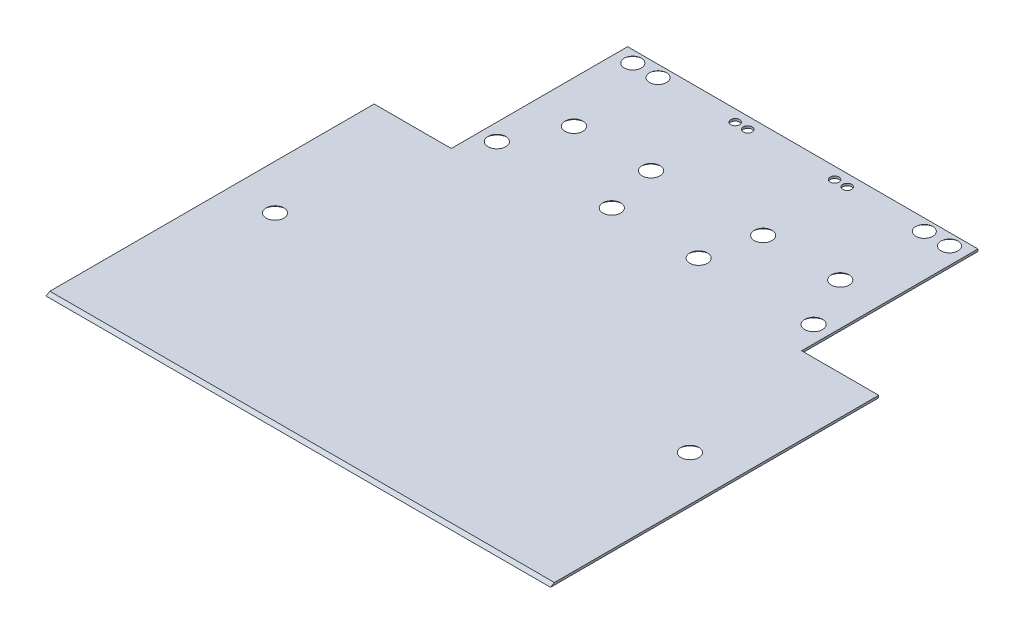
from build123d import *

# Parameters (mm, degrees)
SALIENTE_EXTRUIR1_DEPTH                      = 0.8
CORTAR_EXTRUIR1_REACH                        = 203.248
CORTAR_EXTRUIR2_REACH                        = 129.282
CROQUIS3_R                                   = 1.585
CORTAR_EXTRUIR3_REACH                        = 129.282
CROQUIS4_R                                   = 1.585
CORTAR_EXTRUIR4_REACH                        = 129.282
CROQUIS6_R                                   = 1.585
CORTAR_EXTRUIR5_REACH                        = 129.282
CROQUIS7_R                                   = 1.585
CROQUIS15_R                                  = 4
CORTAR_EXTRUIR6_DEPTH                        = 2
CORTAR_EXTRUIR6_DRAFT                        = -50.5
CORTAR_EXTRUIR6_PROFILE_2_DEPTH              = 2
CORTAR_EXTRUIR6_PROFILE_2_DRAFT              = -50.5
CORTAR_EXTRUIR6_PROFILE_3_DEPTH              = 2
CORTAR_EXTRUIR6_PROFILE_3_DRAFT              = -50.5
CORTAR_EXTRUIR6_PROFILE_4_DEPTH              = 2
CORTAR_EXTRUIR6_PROFILE_4_DRAFT              = -50.5
CORTAR_EXTRUIR6_PROFILE_5_DEPTH              = 2
CORTAR_EXTRUIR6_PROFILE_5_DRAFT              = -50.5
CORTAR_EXTRUIR6_PROFILE_6_DEPTH              = 2
CORTAR_EXTRUIR6_PROFILE_6_DRAFT              = -50.5
CORTAR_EXTRUIR6_PROFILE_7_DEPTH              = 2
CORTAR_EXTRUIR6_PROFILE_7_DRAFT              = -50.5
SIMETR_A3_COPY_1_SKETCH_R                    = 4
SIMETR_A3_COPY_1_DEPTH                       = 2
SIMETR_A3_COPY_1_DRAFT                       = -50.5
SIMETR_A3_COPY_2_SKETCH_R                    = 4
SIMETR_A3_COPY_2_DEPTH                       = 2
SIMETR_A3_COPY_2_DRAFT                       = -50.5
SIMETR_A3_COPY_3_SKETCH_R                    = 4
SIMETR_A3_COPY_3_DEPTH                       = 2
SIMETR_A3_COPY_3_DRAFT                       = -50.5
SIMETR_A3_COPY_4_SKETCH_R                    = 4
SIMETR_A3_COPY_4_DEPTH                       = 2
SIMETR_A3_COPY_4_DRAFT                       = -50.5
SIMETR_A3_COPY_5_SKETCH_R                    = 4
SIMETR_A3_COPY_5_DEPTH                       = 2
SIMETR_A3_COPY_5_DRAFT                       = -50.5
SIMETR_A3_COPY_6_SKETCH_R                    = 4
SIMETR_A3_COPY_6_DEPTH                       = 2
SIMETR_A3_COPY_6_DRAFT                       = -50.5
SIMETR_A3_COPY_7_SKETCH_R                    = 4
SIMETR_A3_COPY_7_DEPTH                       = 2
SIMETR_A3_COPY_7_DRAFT                       = -50.5
SIMETR_A3_COPY_8_SKETCH_R                    = 4
SIMETR_A3_COPY_8_DEPTH                       = 2
SIMETR_A3_COPY_8_DRAFT                       = -50.5
SIMETR_A3_COPY_9_SKETCH_R                    = 4
SIMETR_A3_COPY_9_DEPTH                       = 2
SIMETR_A3_COPY_9_DRAFT                       = -50.5
SIMETR_A3_COPY_10_SKETCH_R                   = 4
SIMETR_A3_COPY_10_DEPTH                      = 2
SIMETR_A3_COPY_10_DRAFT                      = -50.5
SIMETR_A3_COPY_11_SKETCH_R                   = 4
SIMETR_A3_COPY_11_DEPTH                      = 2
SIMETR_A3_COPY_11_DRAFT                      = -50.5
SIMETR_A3_COPY_12_SKETCH_R                   = 4
SIMETR_A3_COPY_12_DEPTH                      = 2
SIMETR_A3_COPY_12_DRAFT                      = -50.5
SIMETR_A3_COPY_13_SKETCH_R                   = 4
SIMETR_A3_COPY_13_DEPTH                      = 2
SIMETR_A3_COPY_13_DRAFT                      = -50.5
AVELLANADO_PARA_TORNILLO_CON_CABEZA_2_COUNT  = 2
AVELLANADO_PARA_TORNILLO_CON_CABEZA_2_PITCH  = 64.066814151
AVELLANADO_PARA_TORNILLO_CON_CABEZA_3_COUNT  = 2
AVELLANADO_PARA_TORNILLO_CON_CABEZA_3_PITCH  = 84.398647009
AVELLANADO_PARA_TORNILLO_CON_CABEZA_4_COUNT  = 2
AVELLANADO_PARA_TORNILLO_CON_CABEZA_4_PITCH  = 96.627540675
AVELLANADO_PARA_TORNILLO_CON_CABEZA_5_COUNT  = 2
AVELLANADO_PARA_TORNILLO_CON_CABEZA_5_PITCH  = 84.973858777
AVELLANADO_PARA_TORNILLO_CON_CABEZA_6_COUNT  = 2
AVELLANADO_PARA_TORNILLO_CON_CABEZA_6_PITCH  = 108.667183066
AVELLANADO_PARA_TORNILLO_CON_CABEZA_7_COUNT  = 2
AVELLANADO_PARA_TORNILLO_CON_CABEZA_7_PITCH  = 123.518750062
AVELLANADO_PARA_TORNILLO_CON_CABEZA_8_COUNT  = 2
AVELLANADO_PARA_TORNILLO_CON_CABEZA_8_PITCH  = 145.544259993
AVELLANADO_PARA_TORNILLO_CON_CABEZA_9_COUNT  = 2
AVELLANADO_PARA_TORNILLO_CON_CABEZA_9_PITCH  = 144.321019521
AVELLANADO_PARA_TORNILLO_CON_CABEZA_10_COUNT = 2
AVELLANADO_PARA_TORNILLO_CON_CABEZA_10_PITCH = 148


with BuildPart() as part:
    # Croquis1 → Saliente-Extruir1 (new body)
    with BuildSketch(Plane(origin=(0, 0, 0), x_dir=(1, 0, 0), z_dir=(0, 1, 0))):
        Polygon((-62.5, 90), (-62.5, 27.08), (-90, 27.08), (-90, -90), (90, -90), (90, 27.08), (62.5, 27.08), (62.5, 90), align=None)
    extrude(amount=SALIENTE_EXTRUIR1_DEPTH)

    # Croquis2 → Cortar-Extruir1 (cut, up to next)
    with BuildSketch(Plane.ZY.offset(90), mode=Mode.PRIVATE) as cortar_extruir1_sk1:
        Polygon((90, 0), (88.614359354, 0.8), (90, 0.8), align=None)
    cortar_extruir1_tool1 = extrude(cortar_extruir1_sk1.sketch, amount=-CORTAR_EXTRUIR1_REACH, mode=Mode.PRIVATE) & part.part
    add(cortar_extruir1_tool1.solids().sort_by_distance((-90, 0.533333, 89.53812))[0], mode=Mode.SUBTRACT)

    # Croquis3 → Cortar-Extruir2 (cut, up to next)
    with BuildSketch(Plane(origin=(0, 0.8, 0), x_dir=(1, 0, 0), z_dir=(0, 1, 0)), mode=Mode.PRIVATE) as cortar_extruir2_sk1:
        with Locations((74, -24.279339937)):
            Circle(CROQUIS3_R)
    cortar_extruir2_tool1 = extrude(cortar_extruir2_sk1.sketch, amount=-CORTAR_EXTRUIR2_REACH, mode=Mode.PRIVATE) & part.part
    cortar_extruir2 = cortar_extruir2_tool1.solids().sort_by_distance((74, 0.8, 24.27934))[0]
    add(cortar_extruir2, mode=Mode.SUBTRACT)

    # Simetría1: Cortar-Extruir2 across plane
    add(cortar_extruir2.mirror(Plane(origin=(0, 0, 0), x_dir=(0, 0, 1), z_dir=(1, 0, 0))), mode=Mode.SUBTRACT)

    # Croquis4 → Cortar-Extruir3 (cut, up to next)
    with BuildSketch(Plane(origin=(0, 0.8, 0), x_dir=(1, 0, 0), z_dir=(0, 1, 0)), mode=Mode.PRIVATE) as cortar_extruir3_sk1:
        with Locations((-56.5, 37.351063887)):
            Circle(CROQUIS4_R)
    cortar_extruir3_tool1 = extrude(cortar_extruir3_sk1.sketch, amount=-CORTAR_EXTRUIR3_REACH, mode=Mode.PRIVATE) & part.part
    # Croquis4 → Cortar-Extruir3 (cut, up to next)
    with BuildSketch(Plane(origin=(0, 0.8, 0), x_dir=(1, 0, 0), z_dir=(0, 1, 0)), mode=Mode.PRIVATE) as cortar_extruir3_sk2:
        with Locations((-15.5, 37.351063887)):
            Circle(CROQUIS4_R)
    cortar_extruir3_tool2 = extrude(cortar_extruir3_sk2.sketch, amount=-CORTAR_EXTRUIR3_REACH, mode=Mode.PRIVATE) & part.part
    # Croquis4 → Cortar-Extruir3 (cut, up to next)
    with BuildSketch(Plane(origin=(0, 0.8, 0), x_dir=(1, 0, 0), z_dir=(0, 1, 0)), mode=Mode.PRIVATE) as cortar_extruir3_sk3:
        with Locations((-15.5, 85.851063887)):
            Circle(CROQUIS4_R)
    cortar_extruir3_tool3 = extrude(cortar_extruir3_sk3.sketch, amount=-CORTAR_EXTRUIR3_REACH, mode=Mode.PRIVATE) & part.part
    # Croquis4 → Cortar-Extruir3 (cut, up to next)
    with BuildSketch(Plane(origin=(0, 0.8, 0), x_dir=(1, 0, 0), z_dir=(0, 1, 0)), mode=Mode.PRIVATE) as cortar_extruir3_sk4:
        with Locations((-56.5, 85.851063887)):
            Circle(CROQUIS4_R)
    cortar_extruir3_tool4 = extrude(cortar_extruir3_sk4.sketch, amount=-CORTAR_EXTRUIR3_REACH, mode=Mode.PRIVATE) & part.part
    add(cortar_extruir3_tool1.solids().sort_by_distance((-56.5, 0.8, -37.351064))[0], mode=Mode.SUBTRACT)
    add(cortar_extruir3_tool2.solids().sort_by_distance((-15.5, 0.8, -37.351064))[0], mode=Mode.SUBTRACT)
    add(cortar_extruir3_tool3.solids().sort_by_distance((-15.5, 0.8, -85.851064))[0], mode=Mode.SUBTRACT)
    add(cortar_extruir3_tool4.solids().sort_by_distance((-56.5, 0.8, -85.851064))[0], mode=Mode.SUBTRACT)

    # Croquis6 → Cortar-Extruir4 (cut, up to next)
    with BuildSketch(Plane(origin=(0, 0.8, 0), x_dir=(1, 0, 0), z_dir=(0, 1, 0)), mode=Mode.PRIVATE) as cortar_extruir4_sk1:
        with Locations((56.5, 85.851063887)):
            Circle(CROQUIS6_R)
    cortar_extruir4_tool1 = extrude(cortar_extruir4_sk1.sketch, amount=-CORTAR_EXTRUIR4_REACH, mode=Mode.PRIVATE) & part.part
    # Croquis6 → Cortar-Extruir4 (cut, up to next)
    with BuildSketch(Plane(origin=(0, 0.8, 0), x_dir=(1, 0, 0), z_dir=(0, 1, 0)), mode=Mode.PRIVATE) as cortar_extruir4_sk2:
        with Locations((15.5, 85.851063887)):
            Circle(CROQUIS6_R)
    cortar_extruir4_tool2 = extrude(cortar_extruir4_sk2.sketch, amount=-CORTAR_EXTRUIR4_REACH, mode=Mode.PRIVATE) & part.part
    # Croquis6 → Cortar-Extruir4 (cut, up to next)
    with BuildSketch(Plane(origin=(0, 0.8, 0), x_dir=(1, 0, 0), z_dir=(0, 1, 0)), mode=Mode.PRIVATE) as cortar_extruir4_sk3:
        with Locations((15.5, 37.351063887)):
            Circle(CROQUIS6_R)
    cortar_extruir4_tool3 = extrude(cortar_extruir4_sk3.sketch, amount=-CORTAR_EXTRUIR4_REACH, mode=Mode.PRIVATE) & part.part
    # Croquis6 → Cortar-Extruir4 (cut, up to next)
    with BuildSketch(Plane(origin=(0, 0.8, 0), x_dir=(1, 0, 0), z_dir=(0, 1, 0)), mode=Mode.PRIVATE) as cortar_extruir4_sk4:
        with Locations((56.5, 37.351063887)):
            Circle(CROQUIS6_R)
    cortar_extruir4_tool4 = extrude(cortar_extruir4_sk4.sketch, amount=-CORTAR_EXTRUIR4_REACH, mode=Mode.PRIVATE) & part.part
    add(cortar_extruir4_tool1.solids().sort_by_distance((56.5, 0.8, -85.851064))[0], mode=Mode.SUBTRACT)
    add(cortar_extruir4_tool2.solids().sort_by_distance((15.5, 0.8, -85.851064))[0], mode=Mode.SUBTRACT)
    add(cortar_extruir4_tool3.solids().sort_by_distance((15.5, 0.8, -37.351064))[0], mode=Mode.SUBTRACT)
    add(cortar_extruir4_tool4.solids().sort_by_distance((56.5, 0.8, -37.351064))[0], mode=Mode.SUBTRACT)

    # Croquis7 → Cortar-Extruir5 (cut, up to next)
    with BuildSketch(Plane(origin=(0, 0.8, 0), x_dir=(1, 0, 0), z_dir=(0, 1, 0)), mode=Mode.PRIVATE) as cortar_extruir5_sk1:
        with Locations((-20, 85.851063887)):
            Circle(CROQUIS7_R)
    cortar_extruir5_tool1 = extrude(cortar_extruir5_sk1.sketch, amount=-CORTAR_EXTRUIR5_REACH, mode=Mode.PRIVATE) & part.part
    # Croquis7 → Cortar-Extruir5 (cut, up to next)
    with BuildSketch(Plane(origin=(0, 0.8, 0), x_dir=(1, 0, 0), z_dir=(0, 1, 0)), mode=Mode.PRIVATE) as cortar_extruir5_sk2:
        with Locations((-47.5, 85.851063887)):
            Circle(CROQUIS7_R)
    cortar_extruir5_tool2 = extrude(cortar_extruir5_sk2.sketch, amount=-CORTAR_EXTRUIR5_REACH, mode=Mode.PRIVATE) & part.part
    # Croquis7 → Cortar-Extruir5 (cut, up to next)
    with BuildSketch(Plane(origin=(0, 0.8, 0), x_dir=(1, 0, 0), z_dir=(0, 1, 0)), mode=Mode.PRIVATE) as cortar_extruir5_sk3:
        with Locations((-47.5, 55.851063887)):
            Circle(CROQUIS7_R)
    cortar_extruir5_tool3 = extrude(cortar_extruir5_sk3.sketch, amount=-CORTAR_EXTRUIR5_REACH, mode=Mode.PRIVATE) & part.part
    # Croquis7 → Cortar-Extruir5 (cut, up to next)
    with BuildSketch(Plane(origin=(0, 0.8, 0), x_dir=(1, 0, 0), z_dir=(0, 1, 0)), mode=Mode.PRIVATE) as cortar_extruir5_sk4:
        with Locations((-20, 55.851063887)):
            Circle(CROQUIS7_R)
    cortar_extruir5_tool4 = extrude(cortar_extruir5_sk4.sketch, amount=-CORTAR_EXTRUIR5_REACH, mode=Mode.PRIVATE) & part.part
    cortar_extruir5_1 = cortar_extruir5_tool1.solids().sort_by_distance((-20, 0.8, -85.851064))[0]
    add(cortar_extruir5_1, mode=Mode.SUBTRACT)
    cortar_extruir5_2 = cortar_extruir5_tool2.solids().sort_by_distance((-47.5, 0.8, -85.851064))[0]
    add(cortar_extruir5_2, mode=Mode.SUBTRACT)
    cortar_extruir5_3 = cortar_extruir5_tool3.solids().sort_by_distance((-47.5, 0.8, -55.851064))[0]
    add(cortar_extruir5_3, mode=Mode.SUBTRACT)
    cortar_extruir5_4 = cortar_extruir5_tool4.solids().sort_by_distance((-20, 0.8, -55.851064))[0]
    add(cortar_extruir5_4, mode=Mode.SUBTRACT)
    cortar_extruir5 = cortar_extruir5_1 + cortar_extruir5_2 + cortar_extruir5_3 + cortar_extruir5_4  # Cortar-Extruir5 as one shape, for the pattern or mirror that repeats it

    # Simetría2: Cortar-Extruir5 across plane
    add(cortar_extruir5.mirror(Plane(origin=(0, 0, 0), x_dir=(0, 0, 1), z_dir=(1, 0, 0))), mode=Mode.SUBTRACT)


with BuildPart() as cortar_extruir6_tool:
    # Croquis15 → Cortar-Extruir6 (with draft: the straight prism first)
    with BuildSketch(Plane(origin=(0, 0, 0), x_dir=(-1, 0, 0), z_dir=(0, -1, 0))):
        with Locations((20, 55.851063887)):
            Circle(CROQUIS15_R)
    extrude(amount=-CORTAR_EXTRUIR6_DEPTH)
    # Cortar-Extruir6: the draft: its side faces are tilted about the plane it starts from
    cortar_extruir6_sides = [cortar_extruir6_tool.faces().sort_by_distance(p)[0] for p in [
        (-16, 1, -55.851063887),
    ]]
    draft(cortar_extruir6_sides, Plane(origin=(0, 0, 0), x_dir=(-1, 0, 0), z_dir=(0, -1, 0)), CORTAR_EXTRUIR6_DRAFT)


with BuildPart() as part_1:
    add(part.part)

    # Cortar-Extruir6: cut by cortar_extruir6_tool
    add(cortar_extruir6_tool.part, mode=Mode.SUBTRACT)


with BuildPart() as cortar_extruir6_profile_2_tool:
    # Croquis15 → Cortar-Extruir6 profile 2 (with draft: the straight prism first)
    with BuildSketch(Plane(origin=(0, 0, 0), x_dir=(-1, 0, 0), z_dir=(0, -1, 0))):
        with Locations((15.5, 37.351063887)):
            Circle(CROQUIS15_R)
    extrude(amount=-CORTAR_EXTRUIR6_PROFILE_2_DEPTH)
    # Cortar-Extruir6 profile 2: the draft: its side faces are tilted about the plane it starts from
    cortar_extruir6_profile_2_sides = [cortar_extruir6_profile_2_tool.faces().sort_by_distance(p)[0] for p in [
        (-11.5, 1, -37.351063887),
    ]]
    draft(cortar_extruir6_profile_2_sides, Plane(origin=(0, 0, 0), x_dir=(-1, 0, 0), z_dir=(0, -1, 0)), CORTAR_EXTRUIR6_PROFILE_2_DRAFT)


with BuildPart() as part_2:
    add(part_1.part)

    # Cortar-Extruir6 profile 2: cut by cortar_extruir6_profile_2_tool
    add(cortar_extruir6_profile_2_tool.part, mode=Mode.SUBTRACT)


with BuildPart() as cortar_extruir6_profile_3_tool:
    # Croquis15 → Cortar-Extruir6 profile 3 (with draft: the straight prism first)
    with BuildSketch(Plane(origin=(0, 0, 0), x_dir=(-1, 0, 0), z_dir=(0, -1, 0))):
        with Locations((56.5, 37.351063887)):
            Circle(CROQUIS15_R)
    extrude(amount=-CORTAR_EXTRUIR6_PROFILE_3_DEPTH)
    # Cortar-Extruir6 profile 3: the draft: its side faces are tilted about the plane it starts from
    cortar_extruir6_profile_3_sides = [cortar_extruir6_profile_3_tool.faces().sort_by_distance(p)[0] for p in [
        (-52.5, 1, -37.351063887),
    ]]
    draft(cortar_extruir6_profile_3_sides, Plane(origin=(0, 0, 0), x_dir=(-1, 0, 0), z_dir=(0, -1, 0)), CORTAR_EXTRUIR6_PROFILE_3_DRAFT)


with BuildPart() as part_3:
    add(part_2.part)

    # Cortar-Extruir6 profile 3: cut by cortar_extruir6_profile_3_tool
    add(cortar_extruir6_profile_3_tool.part, mode=Mode.SUBTRACT)


with BuildPart() as cortar_extruir6_profile_4_tool:
    # Croquis15 → Cortar-Extruir6 profile 4 (with draft: the straight prism first)
    with BuildSketch(Plane(origin=(0, 0, 0), x_dir=(-1, 0, 0), z_dir=(0, -1, 0))):
        with Locations((47.5, 55.851063887)):
            Circle(CROQUIS15_R)
    extrude(amount=-CORTAR_EXTRUIR6_PROFILE_4_DEPTH)
    # Cortar-Extruir6 profile 4: the draft: its side faces are tilted about the plane it starts from
    cortar_extruir6_profile_4_sides = [cortar_extruir6_profile_4_tool.faces().sort_by_distance(p)[0] for p in [
        (-43.5, 1, -55.851063887),
    ]]
    draft(cortar_extruir6_profile_4_sides, Plane(origin=(0, 0, 0), x_dir=(-1, 0, 0), z_dir=(0, -1, 0)), CORTAR_EXTRUIR6_PROFILE_4_DRAFT)


with BuildPart() as part_4:
    add(part_3.part)

    # Cortar-Extruir6 profile 4: cut by cortar_extruir6_profile_4_tool
    add(cortar_extruir6_profile_4_tool.part, mode=Mode.SUBTRACT)


with BuildPart() as cortar_extruir6_profile_5_tool:
    # Croquis15 → Cortar-Extruir6 profile 5 (with draft: the straight prism first)
    with BuildSketch(Plane(origin=(0, 0, 0), x_dir=(-1, 0, 0), z_dir=(0, -1, 0))):
        with Locations((56.5, 85.851063887)):
            Circle(CROQUIS15_R)
    extrude(amount=-CORTAR_EXTRUIR6_PROFILE_5_DEPTH)
    # Cortar-Extruir6 profile 5: the draft: its side faces are tilted about the plane it starts from
    cortar_extruir6_profile_5_sides = [cortar_extruir6_profile_5_tool.faces().sort_by_distance(p)[0] for p in [
        (-52.5, 1, -85.851063887),
    ]]
    draft(cortar_extruir6_profile_5_sides, Plane(origin=(0, 0, 0), x_dir=(-1, 0, 0), z_dir=(0, -1, 0)), CORTAR_EXTRUIR6_PROFILE_5_DRAFT)


with BuildPart() as part_5:
    add(part_4.part)

    # Cortar-Extruir6 profile 5: cut by cortar_extruir6_profile_5_tool
    add(cortar_extruir6_profile_5_tool.part, mode=Mode.SUBTRACT)


with BuildPart() as cortar_extruir6_profile_6_tool:
    # Croquis15 → Cortar-Extruir6 profile 6 (with draft: the straight prism first)
    with BuildSketch(Plane(origin=(0, 0, 0), x_dir=(-1, 0, 0), z_dir=(0, -1, 0))):
        with Locations((47.5, 85.851063887)):
            Circle(CROQUIS15_R)
    extrude(amount=-CORTAR_EXTRUIR6_PROFILE_6_DEPTH)
    # Cortar-Extruir6 profile 6: the draft: its side faces are tilted about the plane it starts from
    cortar_extruir6_profile_6_sides = [cortar_extruir6_profile_6_tool.faces().sort_by_distance(p)[0] for p in [
        (-43.5, 1, -85.851063887),
    ]]
    draft(cortar_extruir6_profile_6_sides, Plane(origin=(0, 0, 0), x_dir=(-1, 0, 0), z_dir=(0, -1, 0)), CORTAR_EXTRUIR6_PROFILE_6_DRAFT)


with BuildPart() as part_6:
    add(part_5.part)

    # Cortar-Extruir6 profile 6: cut by cortar_extruir6_profile_6_tool
    add(cortar_extruir6_profile_6_tool.part, mode=Mode.SUBTRACT)


with BuildPart() as cortar_extruir6_profile_7_tool:
    # Croquis15 → Cortar-Extruir6 profile 7 (with draft: the straight prism first)
    with BuildSketch(Plane(origin=(0, 0, 0), x_dir=(-1, 0, 0), z_dir=(0, -1, 0))):
        with Locations((74, -24.279339937)):
            Circle(CROQUIS15_R)
    extrude(amount=-CORTAR_EXTRUIR6_PROFILE_7_DEPTH)
    # Cortar-Extruir6 profile 7: the draft: its side faces are tilted about the plane it starts from
    cortar_extruir6_profile_7_sides = [cortar_extruir6_profile_7_tool.faces().sort_by_distance(p)[0] for p in [
        (-70, 1, 24.279339937),
    ]]
    draft(cortar_extruir6_profile_7_sides, Plane(origin=(0, 0, 0), x_dir=(-1, 0, 0), z_dir=(0, -1, 0)), CORTAR_EXTRUIR6_PROFILE_7_DRAFT)


with BuildPart() as part_7:
    add(part_6.part)

    # Cortar-Extruir6 profile 7: cut by cortar_extruir6_profile_7_tool
    add(cortar_extruir6_profile_7_tool.part, mode=Mode.SUBTRACT)


with BuildPart() as simetr_a3_copy_1_tool:
    # Simetría3 copy 1 sketch → Simetría3 copy 1 (with draft: the straight prism first)
    with BuildSketch(Plane.XZ):
        with Locations((20, -55.851063887)):
            Circle(SIMETR_A3_COPY_1_SKETCH_R)
    extrude(amount=-SIMETR_A3_COPY_1_DEPTH)
    # Simetría3 copy 1: the draft: its side faces are tilted about the plane it starts from
    simetr_a3_copy_1_sides = [simetr_a3_copy_1_tool.faces().sort_by_distance(p)[0] for p in [
        (16, 1, -55.851063887),
    ]]
    draft(simetr_a3_copy_1_sides, Plane.XZ, SIMETR_A3_COPY_1_DRAFT)


with BuildPart() as part_8:
    add(part_7.part)

    # Simetría3 copy 1: cut by simetr_a3_copy_1_tool
    add(simetr_a3_copy_1_tool.part, mode=Mode.SUBTRACT)


with BuildPart() as simetr_a3_copy_2_tool:
    # Simetría3 copy 2 sketch → Simetría3 copy 2 (with draft: the straight prism first)
    with BuildSketch(Plane.XZ):
        with Locations((15.5, -37.351063887)):
            Circle(SIMETR_A3_COPY_2_SKETCH_R)
    extrude(amount=-SIMETR_A3_COPY_2_DEPTH)
    # Simetría3 copy 2: the draft: its side faces are tilted about the plane it starts from
    simetr_a3_copy_2_sides = [simetr_a3_copy_2_tool.faces().sort_by_distance(p)[0] for p in [
        (11.5, 1, -37.351063887),
    ]]
    draft(simetr_a3_copy_2_sides, Plane.XZ, SIMETR_A3_COPY_2_DRAFT)


with BuildPart() as part_9:
    add(part_8.part)

    # Simetría3 copy 2: cut by simetr_a3_copy_2_tool
    add(simetr_a3_copy_2_tool.part, mode=Mode.SUBTRACT)


with BuildPart() as simetr_a3_copy_3_tool:
    # Simetría3 copy 3 sketch → Simetría3 copy 3 (with draft: the straight prism first)
    with BuildSketch(Plane.XZ):
        with Locations((56.5, -37.351063887)):
            Circle(SIMETR_A3_COPY_3_SKETCH_R)
    extrude(amount=-SIMETR_A3_COPY_3_DEPTH)
    # Simetría3 copy 3: the draft: its side faces are tilted about the plane it starts from
    simetr_a3_copy_3_sides = [simetr_a3_copy_3_tool.faces().sort_by_distance(p)[0] for p in [
        (52.5, 1, -37.351063887),
    ]]
    draft(simetr_a3_copy_3_sides, Plane.XZ, SIMETR_A3_COPY_3_DRAFT)


with BuildPart() as part_10:
    add(part_9.part)

    # Simetría3 copy 3: cut by simetr_a3_copy_3_tool
    add(simetr_a3_copy_3_tool.part, mode=Mode.SUBTRACT)


with BuildPart() as simetr_a3_copy_4_tool:
    # Simetría3 copy 4 sketch → Simetría3 copy 4 (with draft: the straight prism first)
    with BuildSketch(Plane.XZ):
        with Locations((47.5, -55.851063887)):
            Circle(SIMETR_A3_COPY_4_SKETCH_R)
    extrude(amount=-SIMETR_A3_COPY_4_DEPTH)
    # Simetría3 copy 4: the draft: its side faces are tilted about the plane it starts from
    simetr_a3_copy_4_sides = [simetr_a3_copy_4_tool.faces().sort_by_distance(p)[0] for p in [
        (43.5, 1, -55.851063887),
    ]]
    draft(simetr_a3_copy_4_sides, Plane.XZ, SIMETR_A3_COPY_4_DRAFT)


with BuildPart() as part_11:
    add(part_10.part)

    # Simetría3 copy 4: cut by simetr_a3_copy_4_tool
    add(simetr_a3_copy_4_tool.part, mode=Mode.SUBTRACT)


with BuildPart() as simetr_a3_copy_5_tool:
    # Simetría3 copy 5 sketch → Simetría3 copy 5 (with draft: the straight prism first)
    with BuildSketch(Plane.XZ):
        with Locations((56.5, -85.851063887)):
            Circle(SIMETR_A3_COPY_5_SKETCH_R)
    extrude(amount=-SIMETR_A3_COPY_5_DEPTH)
    # Simetría3 copy 5: the draft: its side faces are tilted about the plane it starts from
    simetr_a3_copy_5_sides = [simetr_a3_copy_5_tool.faces().sort_by_distance(p)[0] for p in [
        (52.5, 1, -85.851063887),
    ]]
    draft(simetr_a3_copy_5_sides, Plane.XZ, SIMETR_A3_COPY_5_DRAFT)


with BuildPart() as part_12:
    add(part_11.part)

    # Simetría3 copy 5: cut by simetr_a3_copy_5_tool
    add(simetr_a3_copy_5_tool.part, mode=Mode.SUBTRACT)


with BuildPart() as simetr_a3_copy_6_tool:
    # Simetría3 copy 6 sketch → Simetría3 copy 6 (with draft: the straight prism first)
    with BuildSketch(Plane.XZ):
        with Locations((47.5, -85.851063887)):
            Circle(SIMETR_A3_COPY_6_SKETCH_R)
    extrude(amount=-SIMETR_A3_COPY_6_DEPTH)
    # Simetría3 copy 6: the draft: its side faces are tilted about the plane it starts from
    simetr_a3_copy_6_sides = [simetr_a3_copy_6_tool.faces().sort_by_distance(p)[0] for p in [
        (43.5, 1, -85.851063887),
    ]]
    draft(simetr_a3_copy_6_sides, Plane.XZ, SIMETR_A3_COPY_6_DRAFT)


with BuildPart() as part_13:
    add(part_12.part)

    # Simetría3 copy 6: cut by simetr_a3_copy_6_tool
    add(simetr_a3_copy_6_tool.part, mode=Mode.SUBTRACT)


with BuildPart() as simetr_a3_copy_7_tool:
    # Simetría3 copy 7 sketch → Simetría3 copy 7 (with draft: the straight prism first)
    with BuildSketch(Plane.XZ):
        with Locations((74, 24.279339937)):
            Circle(SIMETR_A3_COPY_7_SKETCH_R)
    extrude(amount=-SIMETR_A3_COPY_7_DEPTH)
    # Simetría3 copy 7: the draft: its side faces are tilted about the plane it starts from
    simetr_a3_copy_7_sides = [simetr_a3_copy_7_tool.faces().sort_by_distance(p)[0] for p in [
        (70, 1, 24.279339937),
    ]]
    draft(simetr_a3_copy_7_sides, Plane.XZ, SIMETR_A3_COPY_7_DRAFT)


with BuildPart() as part_14:
    add(part_13.part)

    # Simetría3 copy 7: cut by simetr_a3_copy_7_tool
    add(simetr_a3_copy_7_tool.part, mode=Mode.SUBTRACT)


with BuildPart() as simetr_a3_copy_8_tool:
    # Simetría3 copy 8 sketch → Simetría3 copy 8 (with draft: the straight prism first)
    with BuildSketch(Plane.XZ):
        with Locations((15.5, -37.351063887)):
            Circle(SIMETR_A3_COPY_8_SKETCH_R)
    extrude(amount=-SIMETR_A3_COPY_8_DEPTH)
    # Simetría3 copy 8: the draft: its side faces are tilted about the plane it starts from
    simetr_a3_copy_8_sides = [simetr_a3_copy_8_tool.faces().sort_by_distance(p)[0] for p in [
        (11.5, 1, -37.351063887),
    ]]
    draft(simetr_a3_copy_8_sides, Plane.XZ, SIMETR_A3_COPY_8_DRAFT)


with BuildPart() as part_15:
    add(part_14.part)

    # Simetría3 copy 8: cut by simetr_a3_copy_8_tool
    add(simetr_a3_copy_8_tool.part, mode=Mode.SUBTRACT)


with BuildPart() as simetr_a3_copy_9_tool:
    # Simetría3 copy 9 sketch → Simetría3 copy 9 (with draft: the straight prism first)
    with BuildSketch(Plane.XZ):
        with Locations((56.5, -37.351063887)):
            Circle(SIMETR_A3_COPY_9_SKETCH_R)
    extrude(amount=-SIMETR_A3_COPY_9_DEPTH)
    # Simetría3 copy 9: the draft: its side faces are tilted about the plane it starts from
    simetr_a3_copy_9_sides = [simetr_a3_copy_9_tool.faces().sort_by_distance(p)[0] for p in [
        (52.5, 1, -37.351063887),
    ]]
    draft(simetr_a3_copy_9_sides, Plane.XZ, SIMETR_A3_COPY_9_DRAFT)


with BuildPart() as part_16:
    add(part_15.part)

    # Simetría3 copy 9: cut by simetr_a3_copy_9_tool
    add(simetr_a3_copy_9_tool.part, mode=Mode.SUBTRACT)


with BuildPart() as simetr_a3_copy_10_tool:
    # Simetría3 copy 10 sketch → Simetría3 copy 10 (with draft: the straight prism first)
    with BuildSketch(Plane.XZ):
        with Locations((47.5, -55.851063887)):
            Circle(SIMETR_A3_COPY_10_SKETCH_R)
    extrude(amount=-SIMETR_A3_COPY_10_DEPTH)
    # Simetría3 copy 10: the draft: its side faces are tilted about the plane it starts from
    simetr_a3_copy_10_sides = [simetr_a3_copy_10_tool.faces().sort_by_distance(p)[0] for p in [
        (43.5, 1, -55.851063887),
    ]]
    draft(simetr_a3_copy_10_sides, Plane.XZ, SIMETR_A3_COPY_10_DRAFT)


with BuildPart() as part_17:
    add(part_16.part)

    # Simetría3 copy 10: cut by simetr_a3_copy_10_tool
    add(simetr_a3_copy_10_tool.part, mode=Mode.SUBTRACT)


with BuildPart() as simetr_a3_copy_11_tool:
    # Simetría3 copy 11 sketch → Simetría3 copy 11 (with draft: the straight prism first)
    with BuildSketch(Plane.XZ):
        with Locations((56.5, -85.851063887)):
            Circle(SIMETR_A3_COPY_11_SKETCH_R)
    extrude(amount=-SIMETR_A3_COPY_11_DEPTH)
    # Simetría3 copy 11: the draft: its side faces are tilted about the plane it starts from
    simetr_a3_copy_11_sides = [simetr_a3_copy_11_tool.faces().sort_by_distance(p)[0] for p in [
        (52.5, 1, -85.851063887),
    ]]
    draft(simetr_a3_copy_11_sides, Plane.XZ, SIMETR_A3_COPY_11_DRAFT)


with BuildPart() as part_18:
    add(part_17.part)

    # Simetría3 copy 11: cut by simetr_a3_copy_11_tool
    add(simetr_a3_copy_11_tool.part, mode=Mode.SUBTRACT)


with BuildPart() as simetr_a3_copy_12_tool:
    # Simetría3 copy 12 sketch → Simetría3 copy 12 (with draft: the straight prism first)
    with BuildSketch(Plane.XZ):
        with Locations((47.5, -85.851063887)):
            Circle(SIMETR_A3_COPY_12_SKETCH_R)
    extrude(amount=-SIMETR_A3_COPY_12_DEPTH)
    # Simetría3 copy 12: the draft: its side faces are tilted about the plane it starts from
    simetr_a3_copy_12_sides = [simetr_a3_copy_12_tool.faces().sort_by_distance(p)[0] for p in [
        (43.5, 1, -85.851063887),
    ]]
    draft(simetr_a3_copy_12_sides, Plane.XZ, SIMETR_A3_COPY_12_DRAFT)


with BuildPart() as part_19:
    add(part_18.part)

    # Simetría3 copy 12: cut by simetr_a3_copy_12_tool
    add(simetr_a3_copy_12_tool.part, mode=Mode.SUBTRACT)


with BuildPart() as simetr_a3_copy_13_tool:
    # Simetría3 copy 13 sketch → Simetría3 copy 13 (with draft: the straight prism first)
    with BuildSketch(Plane.XZ):
        with Locations((74, 24.279339937)):
            Circle(SIMETR_A3_COPY_13_SKETCH_R)
    extrude(amount=-SIMETR_A3_COPY_13_DEPTH)
    # Simetría3 copy 13: the draft: its side faces are tilted about the plane it starts from
    simetr_a3_copy_13_sides = [simetr_a3_copy_13_tool.faces().sort_by_distance(p)[0] for p in [
        (70, 1, 24.279339937),
    ]]
    draft(simetr_a3_copy_13_sides, Plane.XZ, SIMETR_A3_COPY_13_DRAFT)


with BuildPart() as part_20:
    add(part_19.part)

    # Simetría3 copy 13: cut by simetr_a3_copy_13_tool
    add(simetr_a3_copy_13_tool.part, mode=Mode.SUBTRACT)

    # Croquis14 → Avellanado para tornillo con cabeza avellanada en cruz de M3.51 (revolve, cut)
    with BuildSketch(Plane(origin=(74, 0, 24.279339937), x_dir=(0, 0, -1), z_dir=(1, 0, 0))):
        Polygon((0, 0), (0, 0.8), (1.95, 0.8), (1.95, 1.979661988), (4, 0), align=None)
    avellanado_para_tornillo_con_cabeza_avel = revolve(axis=Axis((74, -6.35, 24.279339937), (0, 1, 0)), mode=Mode.SUBTRACT)

    # Avellanado para tornillo con cabeza  2: Avellanado para tornillo con cabeza avellanada en cruz de M3.51 ×2
    with Locations(*[Vector(-0.2731523368520776, 0, -0.9619707900306792) * (i * AVELLANADO_PARA_TORNILLO_CON_CABEZA_2_PITCH) for i in range(1, AVELLANADO_PARA_TORNILLO_CON_CABEZA_2_COUNT)]):
        add(avellanado_para_tornillo_con_cabeza_avel, mode=Mode.SUBTRACT)

    # Avellanado para tornillo con cabeza  3: Avellanado para tornillo con cabeza avellanada en cruz de M3.51 ×2
    with Locations(*[Vector(-0.3139860760708997, 0, -0.9494275875671611) * (i * AVELLANADO_PARA_TORNILLO_CON_CABEZA_3_PITCH) for i in range(1, AVELLANADO_PARA_TORNILLO_CON_CABEZA_3_COUNT)]):
        add(avellanado_para_tornillo_con_cabeza_avel, mode=Mode.SUBTRACT)

    # Avellanado para tornillo con cabeza  4: Avellanado para tornillo con cabeza avellanada en cruz de M3.51 ×2
    with Locations(*[Vector(-0.5588468838460248, 0, -0.8292708607057093) * (i * AVELLANADO_PARA_TORNILLO_CON_CABEZA_4_PITCH) for i in range(1, AVELLANADO_PARA_TORNILLO_CON_CABEZA_4_COUNT)]):
        add(avellanado_para_tornillo_con_cabeza_avel, mode=Mode.SUBTRACT)

    # Avellanado para tornillo con cabeza  5: Avellanado para tornillo con cabeza avellanada en cruz de M3.51 ×2
    with Locations(*[Vector(-0.6884470217308595, 0, -0.725286631801462) * (i * AVELLANADO_PARA_TORNILLO_CON_CABEZA_5_PITCH) for i in range(1, AVELLANADO_PARA_TORNILLO_CON_CABEZA_5_COUNT)]):
        add(avellanado_para_tornillo_con_cabeza_avel, mode=Mode.SUBTRACT)

    # Avellanado para tornillo con cabeza  6: Avellanado para tornillo con cabeza avellanada en cruz de M3.51 ×2
    with Locations(*[Vector(-0.8236157179653746, 0, -0.5671482602639107) * (i * AVELLANADO_PARA_TORNILLO_CON_CABEZA_6_PITCH) for i in range(1, AVELLANADO_PARA_TORNILLO_CON_CABEZA_6_COUNT)]):
        add(avellanado_para_tornillo_con_cabeza_avel, mode=Mode.SUBTRACT)

    # Avellanado para tornillo con cabeza  7: Avellanado para tornillo con cabeza avellanada en cruz de M3.51 ×2
    with Locations(*[Vector(-0.7610180636759967, 0, -0.6487306889294174) * (i * AVELLANADO_PARA_TORNILLO_CON_CABEZA_7_PITCH) for i in range(1, AVELLANADO_PARA_TORNILLO_CON_CABEZA_7_COUNT)]):
        add(avellanado_para_tornillo_con_cabeza_avel, mode=Mode.SUBTRACT)

    # Avellanado para tornillo con cabeza  8: Avellanado para tornillo con cabeza avellanada en cruz de M3.51 ×2
    with Locations(*[Vector(-0.8347976073106893, 0, -0.550556949668559) * (i * AVELLANADO_PARA_TORNILLO_CON_CABEZA_8_PITCH) for i in range(1, AVELLANADO_PARA_TORNILLO_CON_CABEZA_8_COUNT)]):
        add(avellanado_para_tornillo_con_cabeza_avel, mode=Mode.SUBTRACT)

    # Avellanado para tornillo con cabeza  9: Avellanado para tornillo con cabeza avellanada en cruz de M3.51 ×2
    with Locations(*[Vector(-0.9042341887102125, 0, -0.42703692108245617) * (i * AVELLANADO_PARA_TORNILLO_CON_CABEZA_9_PITCH) for i in range(1, AVELLANADO_PARA_TORNILLO_CON_CABEZA_9_COUNT)]):
        add(avellanado_para_tornillo_con_cabeza_avel, mode=Mode.SUBTRACT)

    # Avellanado para tornillo con cabeza  10: Avellanado para tornillo con cabeza avellanada en cruz de M3.51 ×2
    with Locations(*[(-i * AVELLANADO_PARA_TORNILLO_CON_CABEZA_10_PITCH, 0, 0) for i in range(1, AVELLANADO_PARA_TORNILLO_CON_CABEZA_10_COUNT)]):
        add(avellanado_para_tornillo_con_cabeza_avel, mode=Mode.SUBTRACT)


solid = part_20.part
